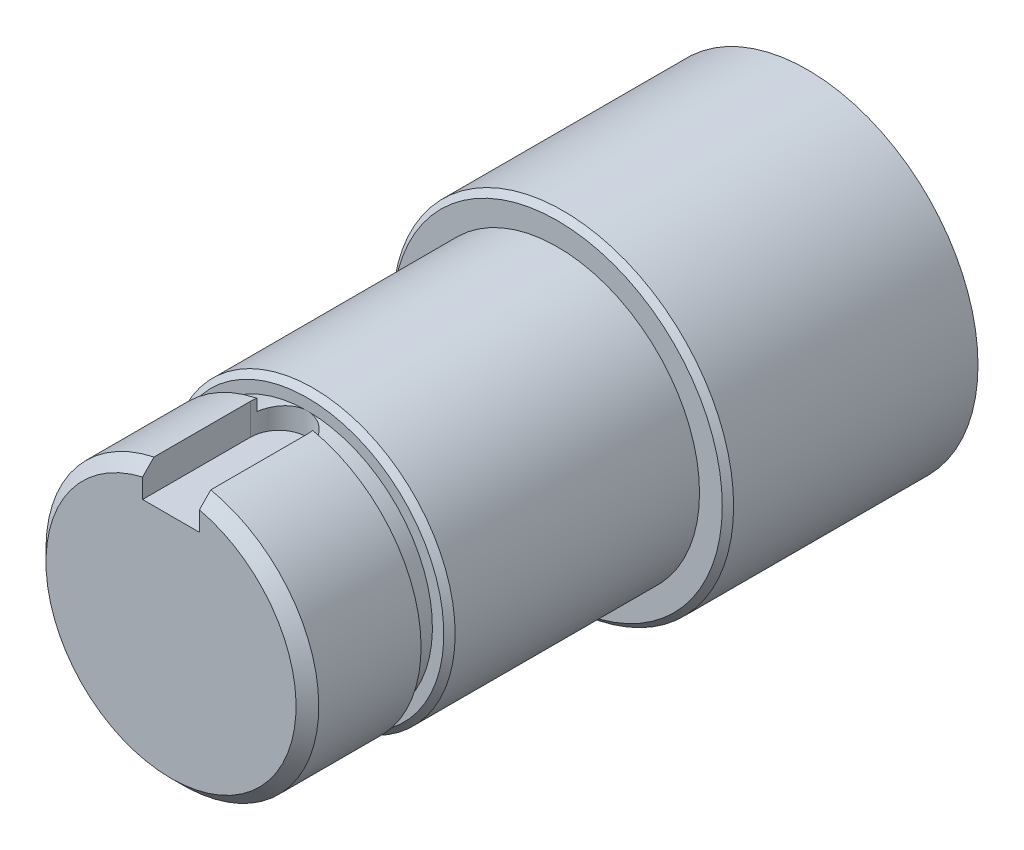
from build123d import *

# Parameters (mm, degrees)
CUT_EXTRUDE_1_DEPTH = 63.745517768
CHAMFER_1_SIZE      = 1
CHAMFER_2_SIZE      = 0.5


with BuildPart() as part:
    # 草图1 → 旋转1 (revolve)
    with BuildSketch(Plane(origin=(0, 0, 0), x_dir=(0, 0, -1), z_dir=(1, 0, 0)), mode=Mode.PRIVATE) as revolve_1_sk:
        Polygon((0, 0), (0, 12), (10, 12), (10, 11), (12, 11), (12, 12.5), (34, 12.5), (34, 15), (56, 15), (56, 0), align=None)
    revolve(revolve_1_sk.sketch.rotate(Axis((0, 0, 0), (0, 0, -1)), 90), axis=Axis((0, 0, 0), (0, 0, -1)))

    # 草图2 → 切除-拉伸1 (cut, through all)
    with BuildSketch(Plane(origin=(0, 9, 0), x_dir=(1, 0, 0), z_dir=(0, 1, 0))):
        with BuildLine():
            Line((-2.5, 9.5), (-2.5, 0))
            Line((-2.5, 0), (2.5, 0))
            Line((2.5, 0), (2.5, 9.5))
            ThreePointArc((2.5, 9.5), (0, 12), (-2.5, 9.5))
        make_face()
    extrude(amount=CUT_EXTRUDE_1_DEPTH, mode=Mode.SUBTRACT)

    # 倒角1
    chamfer_1_edges = [part.edges().sort_by_distance(p)[0] for p in [
        (0, -12, 0),
    ]]
    chamfer(chamfer_1_edges, length=CHAMFER_1_SIZE)

    # 倒角2
    # the kernel refuses this chamfer: 0.5 mm, written as the material it takes off along each edge
    with BuildSketch(Plane(origin=(0, 0, -34), x_dir=(1, 0, 0), z_dir=(0, 1, 0))) as chamfer_2_piece_1:
        Polygon((15 - CHAMFER_2_SIZE, 0), (15, CHAMFER_2_SIZE), (15, 0), align=None)
    revolve(axis=Axis((0, 0, -34), (0, 0, -1)), mode=Mode.SUBTRACT)
    with BuildSketch(Plane(origin=(0, 0, -12), x_dir=(0, 1, 0), z_dir=(-1, 0, 0))) as chamfer_2_piece_2:
        Polygon((12.5 - CHAMFER_2_SIZE, 0), (12.5, CHAMFER_2_SIZE), (12.5, 0), align=None)
    revolve(axis=Axis((0, 0, -12), (0, 0, -1)), revolution_arc=90, mode=Mode.SUBTRACT)
    with BuildSketch(Plane(origin=(0, 0, -12), x_dir=(1, 0, 0), z_dir=(0, 1, 0))) as chamfer_2_piece_3:
        Polygon((12.5 - CHAMFER_2_SIZE, 0), (12.5, CHAMFER_2_SIZE), (12.5, 0), align=None)
    revolve(axis=Axis((0, 0, -12), (0, 0, -1)), revolution_arc=270, mode=Mode.SUBTRACT)


solid = part.part
